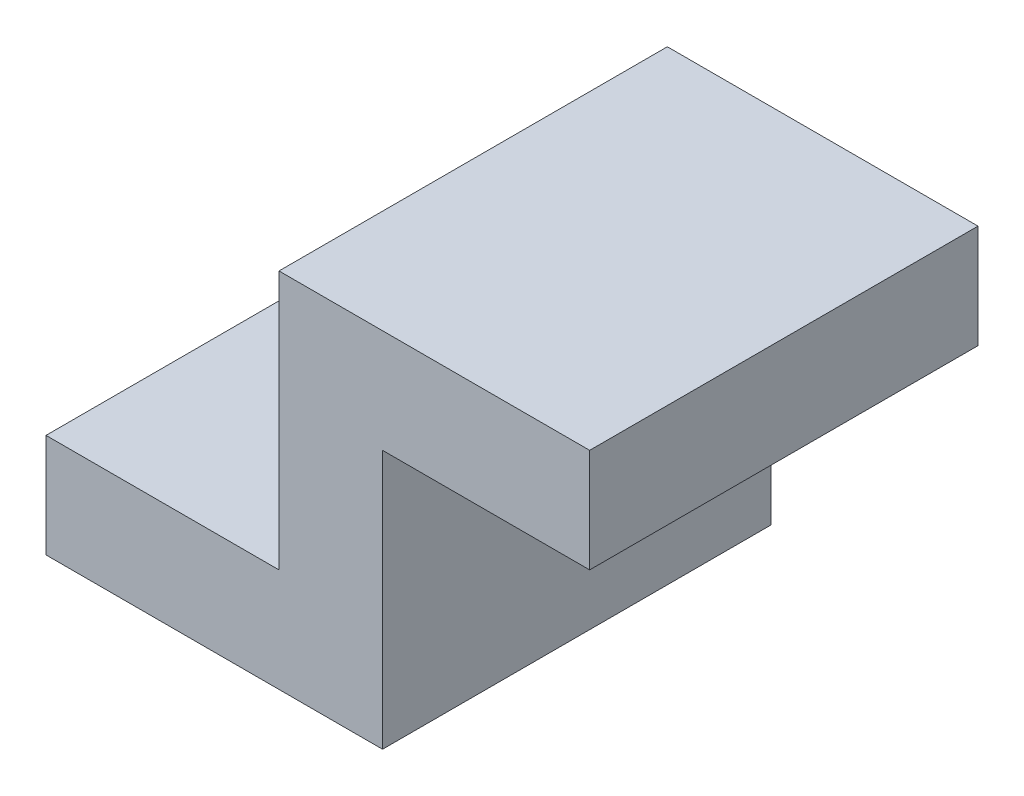
from build123d import *

# Parameters (mm, degrees)
BOSS_EXTRUDE1_DEPTH = 15
SKETCH2_R           = 1.5
CUT_EXTRUDE1_DEPTH  = 25.070361662


with BuildPart() as part:
    # Sketch1 → Boss-Extrude1 (new body)
    with BuildSketch(Plane.XY):
        Polygon((-15.949367089, -5.218918331), (-2.949367089, -5.218918331), (-2.949367089, 4.781081669), (5.050632911, 4.781081669), (5.050632911, 8.781081669), (-6.949367089, 8.781081669), (-6.949367089, -1.218918331), (-15.949367089, -1.218918331), align=None)
    extrude(amount=BOSS_EXTRUDE1_DEPTH)

    # Sketch2 → Cut-Extrude1 (cut, through all)
    with BuildSketch(Plane(origin=(0, -1.218918331, 0), x_dir=(1, 0, 0), z_dir=(0, 1, 0))):
        with Locations((-11.949367089, -7.346473539)):
            Circle(SKETCH2_R)
    extrude(amount=-CUT_EXTRUDE1_DEPTH, mode=Mode.SUBTRACT)


solid = part.part
